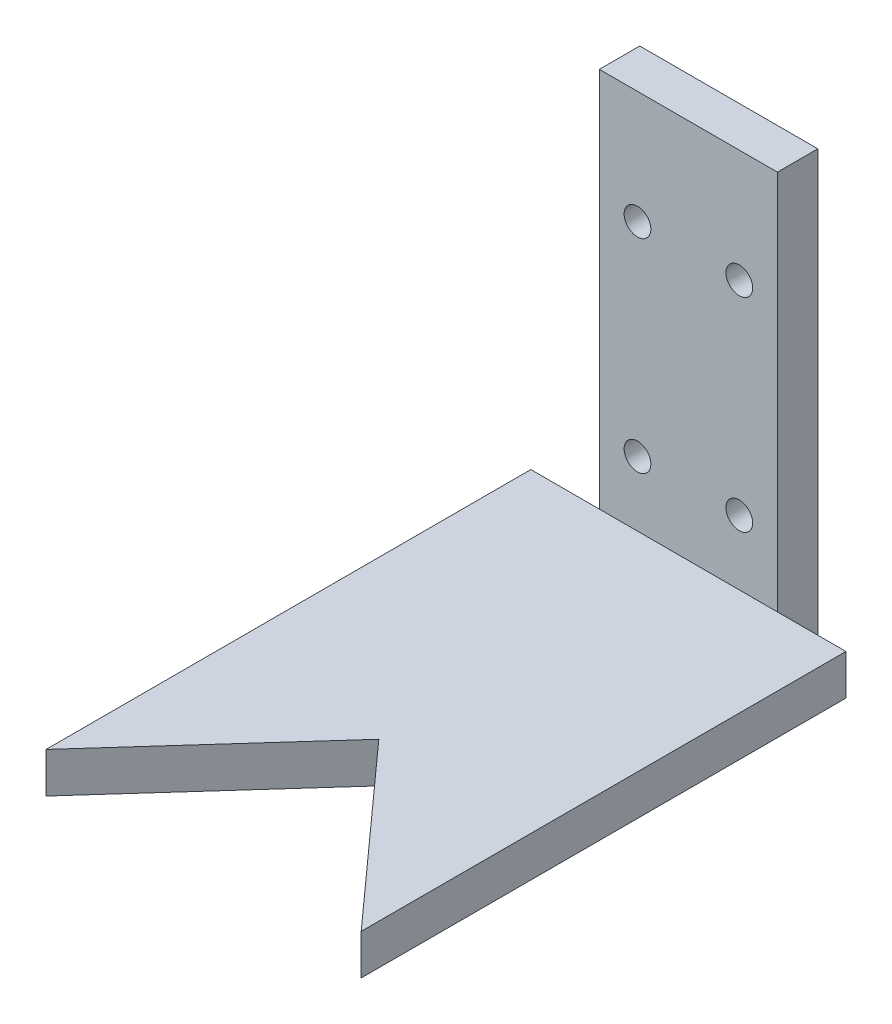
from build123d import *

# Parameters (mm, degrees)
SKETCH1_W             = 27.9908
SKETCH1_H             = 66.2178
BOSS_EXTRUDE1_DEPTH   = 6.35
SKETCH4_W             = 49.53
SKETCH4_H             = 6.35
BOSS_EXTRUDE3_DEPTH   = 76.2
CUT_EXTRUDE1_DEPTH    = 110.091817223
M5X0_8_TAPPED_HOLE1_D = 4.2


with BuildPart() as part:
    # Sketch1 → Boss-Extrude1 (new body)
    with BuildSketch(Plane.XY):
        with Locations((13.9954, 33.1089)):
            Rectangle(SKETCH1_W, SKETCH1_H)
    extrude(amount=BOSS_EXTRUDE1_DEPTH)

    # Sketch4 → Boss-Extrude3 (add)
    with BuildSketch(Plane.XY.offset(6.35)):
        with Locations((13.9954, 3.175)):
            Rectangle(SKETCH4_W, SKETCH4_H)
    extrude(amount=BOSS_EXTRUDE3_DEPTH)

    # Sketch5 → Cut-Extrude1 (cut, through all)
    with BuildSketch(Plane(origin=(0, 6.35, 0), x_dir=(1, 0, 0), z_dir=(0, 1, 0))):
        Polygon((-10.7696, -82.55), (13.9954, -55.009603144), (38.7604, -82.55), align=None)
    extrude(amount=-CUT_EXTRUDE1_DEPTH, mode=Mode.SUBTRACT)

    # M5x0.8 Tapped Hole1 (through all)
    with Locations(Plane(origin=(0, 0, 0), x_dir=(-1, 0, 0), z_dir=(0, 0, -1))):
        with Locations((-21.9964, 48.4886), (-5.9944, 48.4886), (-5.9944, 16.51), (-21.9964, 16.51)):
            Hole(M5X0_8_TAPPED_HOLE1_D / 2)


solid = part.part
